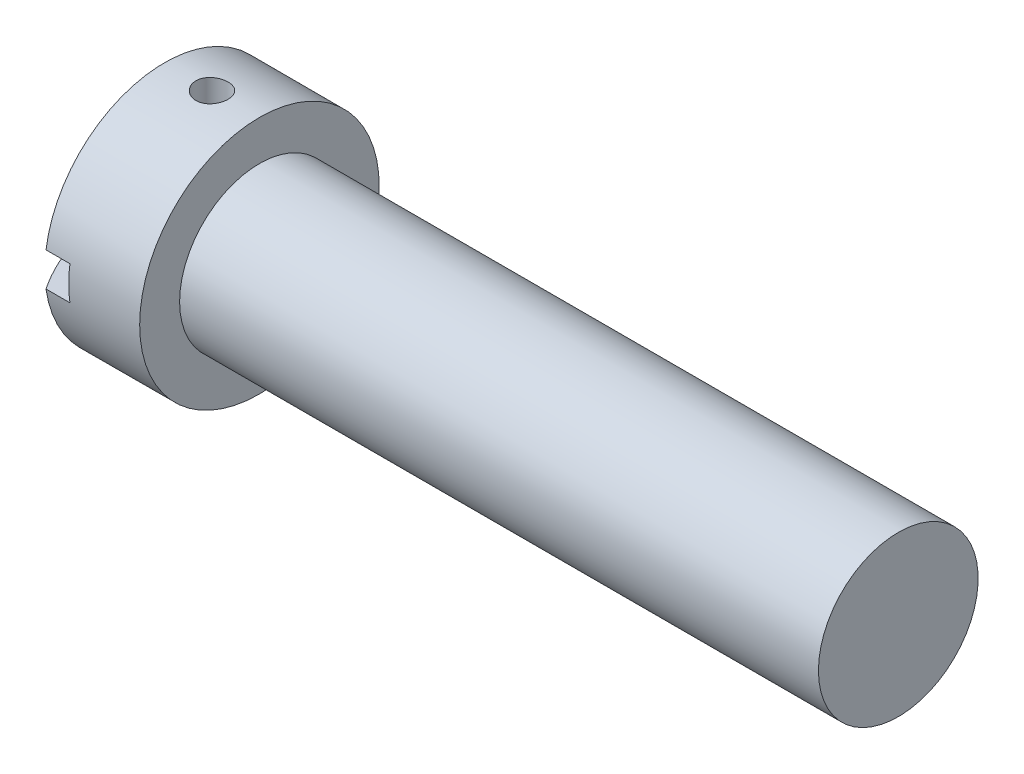
from build123d import *

# Parameters (mm, degrees)
SKETCH2_W          = 19.05
SKETCH2_H          = 2.6924
SLOT_DEPTH         = 4.826
SKETCH6_R          = 1.27889
CUT_EXTRUDE1_DEPTH = 635.762


with BuildPart() as part:
    # BodySke → Base-Revolve (revolve)
    with BuildSketch(Plane.XY):
        with BuildLine():
            Line((10.4648, 6.35), (10.4648, 9.525))
            Line((10.4648, 9.525), (2.921, 9.525))
            ThreePointArc((2.921, 9.525), (0.746656199, 4.981412099), (0, 0))
            Line((0, 0), (61.2648, 0))
            Line((61.2648, 0), (61.2648, 6.35))
            Line((61.2648, 6.35), (10.4648, 6.35))
        make_face()
    revolve(axis=Axis((-25.4, 0, 0), (1, 0, 0)))

    # Sketch2 → Slot (cut)
    with BuildSketch(Plane(origin=(0, 0, 0), x_dir=(0, 0, -1), z_dir=(1, 0, 0))):
        Rectangle(SKETCH2_W, SKETCH2_H)
    extrude(amount=SLOT_DEPTH, mode=Mode.SUBTRACT)

    # Sketch6 → Cut-Extrude1 (cut, symmetric)
    with BuildSketch(Plane(origin=(0, 0, 0), x_dir=(1, 0, 0), z_dir=(0, 1, 0))):
        with Locations((6.6929, 0)):
            Circle(SKETCH6_R)
    extrude(amount=CUT_EXTRUDE1_DEPTH, both=True, mode=Mode.SUBTRACT)


solid = part.part
